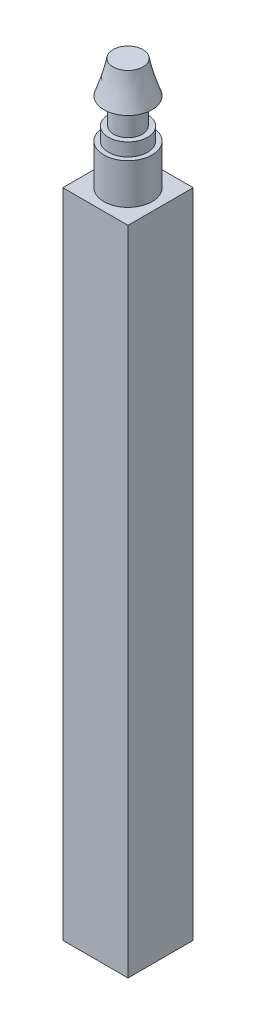
from build123d import *

# Parameters (mm, degrees)
SKETCH1_R           = 1.85
BOSS_EXTRUDE1_DEPTH = 3.1
SKETCH2_R           = 1.5
BOSS_EXTRUDE2_DEPTH = 1
SKETCH3_R           = 1.1
BOSS_EXTRUDE3_DEPTH = 2
SKETCH6_W           = 5
SKETCH6_H           = 5
BOSS_EXTRUDE4_DEPTH = 50
SKETCH7_R           = 1
CUT_EXTRUDE1_DEPTH  = 24


with BuildPart() as part:
    # Sketch1 → Boss-Extrude1 (new body)
    with BuildSketch(Plane(origin=(0, 0, 0), x_dir=(1, 0, 0), z_dir=(0, 1, 0))):
        with Locations(Location((0, 0, 0), (0, 0, 90))):
            Circle(SKETCH1_R)
    extrude(amount=BOSS_EXTRUDE1_DEPTH)

    # Sketch2 → Boss-Extrude2 (add)
    with BuildSketch(Plane(origin=(0, 3.1, 0), x_dir=(1, 0, 0), z_dir=(0, 1, 0))):
        with Locations(Location((0, 0, 0), (0, 0, 270))):
            Circle(SKETCH2_R)
    extrude(amount=BOSS_EXTRUDE2_DEPTH)

    # Sketch3 → Boss-Extrude3 (add)
    with BuildSketch(Plane(origin=(0, 4.1, 0), x_dir=(1, 0, 0), z_dir=(0, 1, 0))):
        with Locations(Location((0, 0, 0), (0, 0, 270))):
            Circle(SKETCH3_R)
    extrude(amount=BOSS_EXTRUDE3_DEPTH)

    # Loft1: read off the stored shape, not the designer's step
    # Loft1: loft between two sections, ruled curve by curve
    loft1_from = [
        Edge.make_bspline([(0, 6.1, 1.85), (3.7, 6.1, 1.85), (3.7, 6.1, -1.85), (0, 6.1, -1.85), (-3.7, 6.1, -1.85), (-3.7, 6.1, 1.85), (0, 6.1, 1.85)], [0, 0, 0, 0, 0.5, 0.5, 0.5, 1, 1, 1, 1], 3, [1, 0.333333333, 0.333333333, 1, 0.333333333, 0.333333333, 1]),
    ]
    loft1_to = [
        Edge.make_bspline([(0.620465421, 8.6, 0.968257539), (2.556980499, 8.6, -0.272673303), (1.316049657, 8.6, -2.209188381), (-0.620465421, 8.6, -0.968257539), (-2.556980499, 8.6, 0.272673303), (-1.316049657, 8.6, 2.209188381), (0.620465421, 8.6, 0.968257539)], [0, 0, 0, 0, 0.5, 0.5, 0.5, 1, 1, 1, 1], 3, [1, 0.333333333, 0.333333333, 1, 0.333333333, 0.333333333, 1]),
    ]
    loft1 = Solid(Shell([*[Face.make_surface_from_curves(loft1_from[k], loft1_to[k]) for k in range(1)], Face(Wire(loft1_from)), Face(Wire(loft1_to))]))
    add(loft1)

    # Sketch6 → Boss-Extrude4 (add)
    with BuildSketch(Plane.XZ):
        Rectangle(SKETCH6_W, SKETCH6_H)
    extrude(amount=BOSS_EXTRUDE4_DEPTH)

    # Sketch7 → Cut-Extrude1 (cut)
    with BuildSketch(Plane.XZ.offset(50)):
        with Locations(Location((0, 0, 0), (0, 0, 270))):
            Circle(SKETCH7_R)
    extrude(amount=-CUT_EXTRUDE1_DEPTH, mode=Mode.SUBTRACT)


solid = part.part
